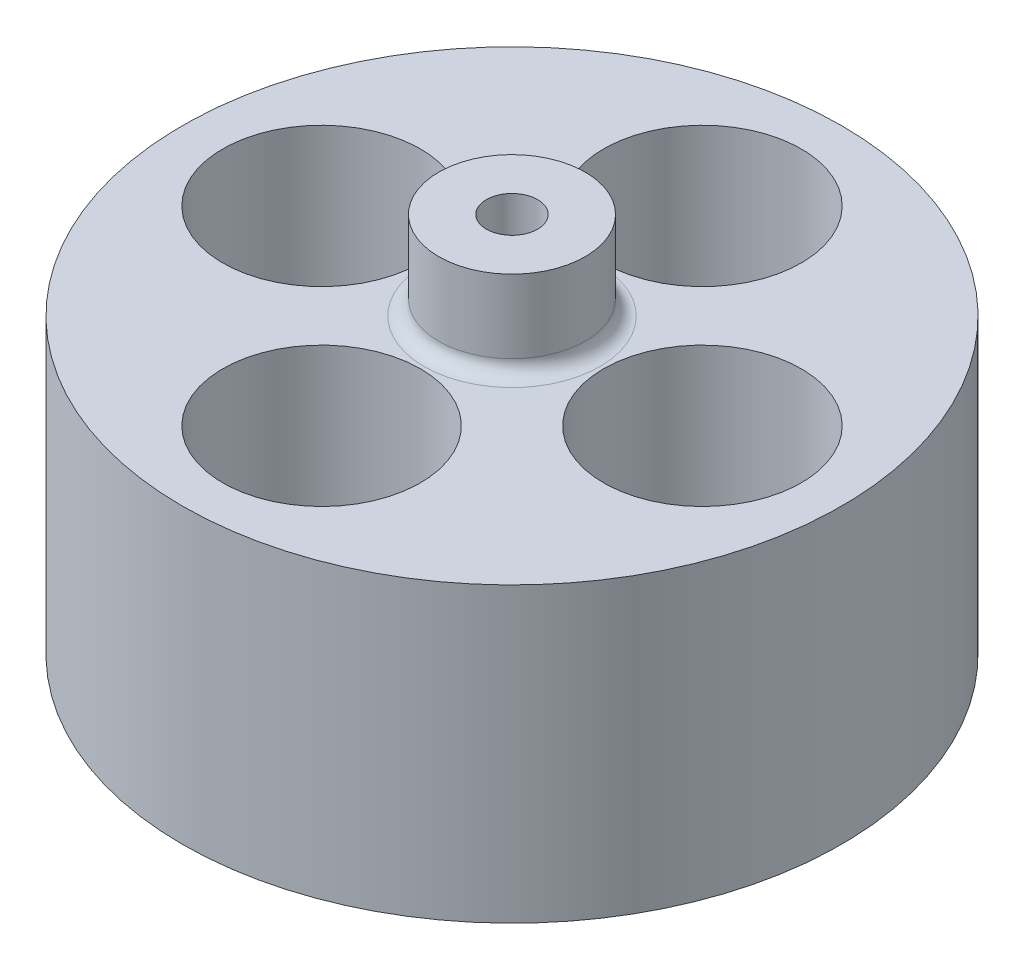
from build123d import *

# Parameters (mm, degrees)
SKETCH1_R           = 22.5
BOSS_EXTRUDE1_DEPTH = 20
SKETCH2_R           = 6.75
CUT_EXTRUDE1_DEPTH  = 10
SKETCH3_R           = 2
CUT_EXTRUDE2_DEPTH  = 35
CIRPATTERN1_COUNT   = 4
SKETCH6_R           = 1.75
CUT_EXTRUDE4_DEPTH  = 45
BOSS_EXTRUDE2_START = 6
SKETCH7_R           = 5
SKETCH7_R_2         = 1.75
BOSS_EXTRUDE2_DEPTH = 6
FILLET1_R           = 1


with BuildPart() as part:
    # Sketch1 → Boss-Extrude1 (new body)
    with BuildSketch(Plane(origin=(0, 0, 0), x_dir=(1, 0, 0), z_dir=(0, 1, 0))):
        Circle(SKETCH1_R)
    extrude(amount=BOSS_EXTRUDE1_DEPTH)

    # Sketch2 → Cut-Extrude1 (cut)
    with BuildSketch(Plane(origin=(0, 20, 0), x_dir=(1, 0, 0), z_dir=(0, 1, 0))):
        with Locations((0, 13)):
            Circle(SKETCH2_R)
    cut_extrude1 = extrude(amount=-CUT_EXTRUDE1_DEPTH, mode=Mode.SUBTRACT)

    # Sketch3 → Cut-Extrude2 (cut)
    with BuildSketch(Plane(origin=(0, 10, 0), x_dir=(1, 0, 0), z_dir=(0, 1, 0))):
        with Locations((0, 13)):
            Circle(SKETCH3_R)
    cut_extrude2 = extrude(amount=-CUT_EXTRUDE2_DEPTH, mode=Mode.SUBTRACT)

    # CirPattern1: Cut-Extrude1, Cut-Extrude2 ×4 about axis
    cirpattern1_axis = Axis((0, 20, 0), (0, 1, 0))
    add([cut_extrude1.rotate(cirpattern1_axis, i * 360 / CIRPATTERN1_COUNT) for i in range(1, CIRPATTERN1_COUNT)], mode=Mode.SUBTRACT)
    add([cut_extrude2.rotate(cirpattern1_axis, i * 360 / CIRPATTERN1_COUNT) for i in range(1, CIRPATTERN1_COUNT)], mode=Mode.SUBTRACT)

    # Sketch6 → Cut-Extrude4 (cut)
    with BuildSketch(Plane(origin=(0, 20, 0), x_dir=(1, 0, 0), z_dir=(0, 1, 0))):
        Circle(SKETCH6_R)
    extrude(amount=-CUT_EXTRUDE4_DEPTH, mode=Mode.SUBTRACT)

    # Sketch7 → Boss-Extrude2 (add)
    with BuildSketch(Plane(origin=(0, 20, 0), x_dir=(1, 0, 0), z_dir=(0, 1, 0)).offset(BOSS_EXTRUDE2_START)):
        Circle(SKETCH7_R)
        Circle(SKETCH7_R_2, mode=Mode.SUBTRACT)
    extrude(amount=-BOSS_EXTRUDE2_DEPTH)

    # Fillet1
    fillet1_edges = [part.edges().sort_by_distance(p)[0] for p in [
        (-5, 20, 0),
    ]]
    fillet(fillet1_edges, radius=FILLET1_R)


solid = part.part
